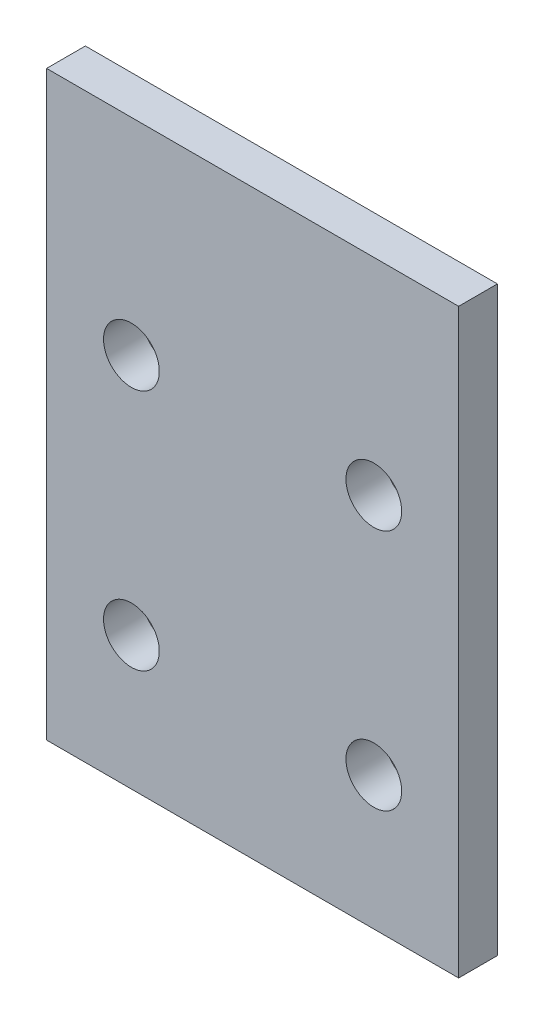
from build123d import *

# Parameters (mm, degrees)
SKETCH_1_W             = 170
SKETCH_1_H             = 240
SKETCH_1_R             = 11.5
SM_BASE_FLANGE_1_DEPTH = 16


# Sheet-metal steps are written as plain solids
with BuildPart() as part:
    # Sketch 1 → Базовая кромка1 (new body)
    with BuildSketch(Plane.XY):
        with Locations((85, -120)):
            Rectangle(SKETCH_1_W, SKETCH_1_H)
        with Locations((135, -185)):
            Circle(SKETCH_1_R, mode=Mode.SUBTRACT)
        with Locations((135, -85)):
            Circle(SKETCH_1_R, mode=Mode.SUBTRACT)
        with Locations(Location((35, -85, 0), (0, 0, 180))):
            Circle(SKETCH_1_R, mode=Mode.SUBTRACT)
        with Locations(Location((35, -185, 0), (0, 0, 180))):
            Circle(SKETCH_1_R, mode=Mode.SUBTRACT)
    extrude(amount=-SM_BASE_FLANGE_1_DEPTH)


solid = part.part
